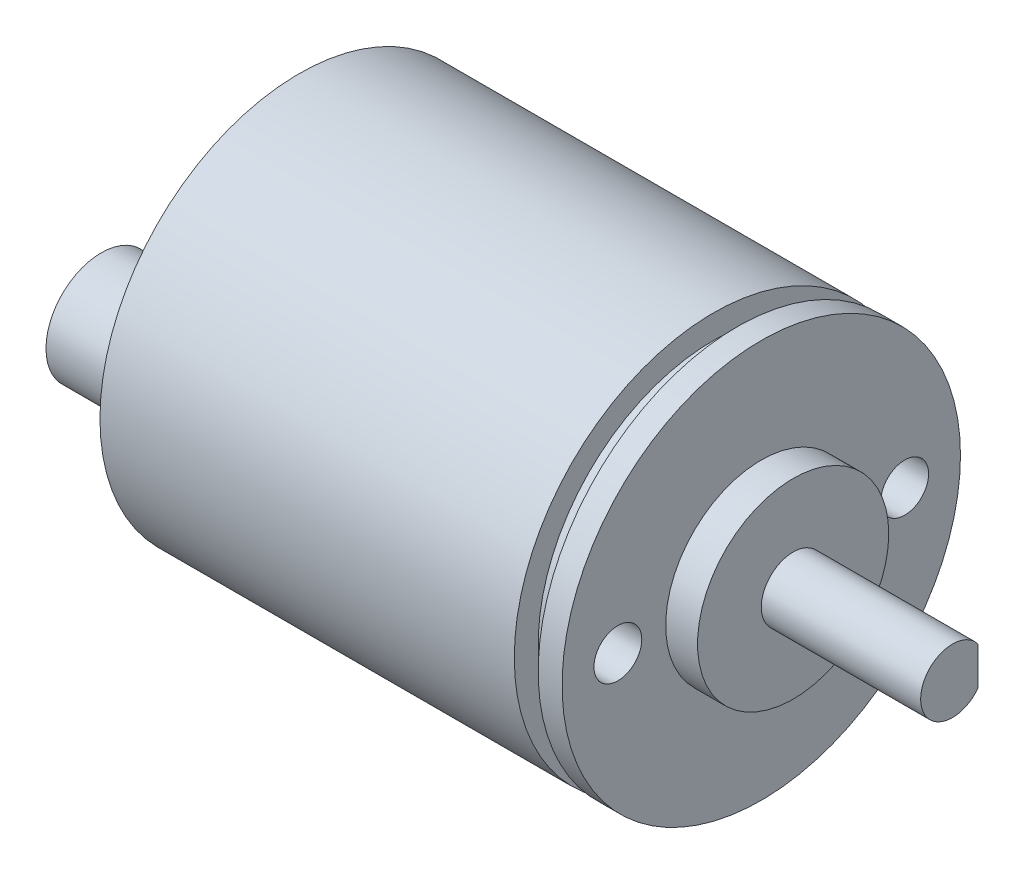
from build123d import *

# Parameters (mm, degrees)
SKETCH1_R           = 12.5
BOSS_EXTRUDE1_DEPTH = 26
SKETCH2_R           = 11
BOSS_EXTRUDE2_DEPTH = 1.5
SKETCH3_R           = 12.5
BOSS_EXTRUDE3_DEPTH = 1.5
SKETCH4_R           = 6
BOSS_EXTRUDE4_DEPTH = 2
SKETCH5_R           = 2
BOSS_EXTRUDE5_DEPTH = 10
SKETCH6_W           = 2.63743778
SKETCH6_H           = 6.664381858
CUT_EXTRUDE1_DEPTH  = 8
SKETCH8_R           = 1.5
CUT_EXTRUDE2_DEPTH  = 6.35
SKETCH9_R           = 3.471368159
BOSS_EXTRUDE6_DEPTH = 5.5


with BuildPart() as part:
    # Sketch1 → Boss-Extrude1 (new body)
    with BuildSketch(Plane(origin=(0, 0, 0), x_dir=(0, 0, -1), z_dir=(1, 0, 0))):
        Circle(SKETCH1_R)
    extrude(amount=BOSS_EXTRUDE1_DEPTH)

    # Sketch2 → Boss-Extrude2 (add)
    with BuildSketch(Plane(origin=(26, 0, 0), x_dir=(0, 0, -1), z_dir=(1, 0, 0))):
        Circle(SKETCH2_R)
    extrude(amount=BOSS_EXTRUDE2_DEPTH)

    # Sketch3 → Boss-Extrude3 (add)
    with BuildSketch(Plane(origin=(27.5, 0, 0), x_dir=(0, 0, -1), z_dir=(1, 0, 0))):
        Circle(SKETCH3_R)
    extrude(amount=BOSS_EXTRUDE3_DEPTH)

    # Sketch4 → Boss-Extrude4 (add)
    with BuildSketch(Plane(origin=(29, 0, 0), x_dir=(0, 0, -1), z_dir=(1, 0, 0))):
        Circle(SKETCH4_R)
    extrude(amount=BOSS_EXTRUDE4_DEPTH)

    # Sketch5 → Boss-Extrude5 (add)
    with BuildSketch(Plane(origin=(31, 0, 0), x_dir=(0, 0, -1), z_dir=(1, 0, 0))):
        Circle(SKETCH5_R)
    extrude(amount=BOSS_EXTRUDE5_DEPTH)

    # Sketch6 → Cut-Extrude1 (cut)
    with BuildSketch(Plane(origin=(41, 0, 0), x_dir=(0, 0, -1), z_dir=(1, 0, 0))):
        with Locations((2.91871889, -0.060449415)):
            Rectangle(SKETCH6_W, SKETCH6_H)
    extrude(amount=-CUT_EXTRUDE1_DEPTH, mode=Mode.SUBTRACT)

    # Sketch8 → Cut-Extrude2 (cut)
    with BuildSketch(Plane(origin=(29, 0, 0), x_dir=(0, 0, -1), z_dir=(1, 0, 0))):
        with Locations((9, 0)):
            Circle(SKETCH8_R)
        with Locations((-9, 0)):
            Circle(SKETCH8_R)
    extrude(amount=-CUT_EXTRUDE2_DEPTH, mode=Mode.SUBTRACT)

    # Sketch9 → Boss-Extrude6 (add)
    with BuildSketch(Plane.ZY):
        with Locations((6.914557356, 0)):
            Circle(SKETCH9_R)
    extrude(amount=BOSS_EXTRUDE6_DEPTH)


solid = part.part
